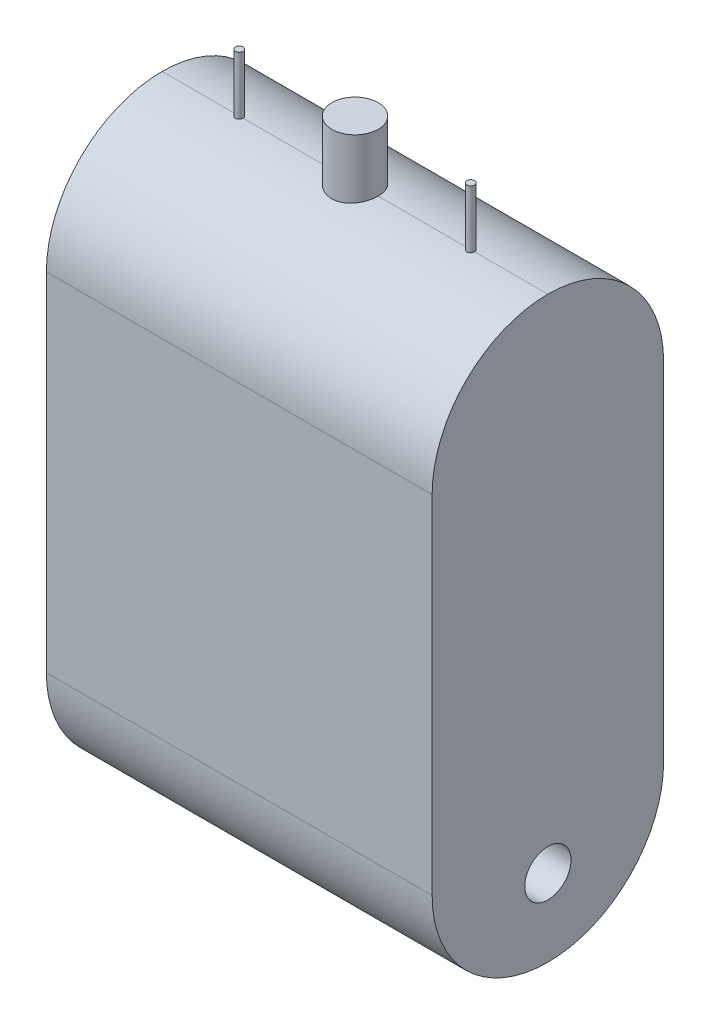
from build123d import *

# Parameters (mm, degrees)
EXTRUDE_1_DEPTH     = 30
SKETCH_2_R          = 3
CUT_EXTRUDE_1_DEPTH = 52
FILLET_1_R          = 15
FILLET_2_R          = 15
FILLET_3_R          = 15
FILLET_4_R          = 15
SKETCH_4_R          = 3
SKETCH_4_R_2        = 0.5
EXTRUDE_2_DEPTH     = 50


with BuildPart() as part:
    # 草图1 → 凸台-拉伸1 (new body)
    with BuildSketch(Plane.XY):
        Polygon((25, 0), (25, 42.5), (-25, 42.5), (-25, -32.5), (25, -32.5), align=None)
    extrude(amount=EXTRUDE_1_DEPTH)

    # 草图2 → 切除-拉伸1 (cut)
    with BuildSketch(Plane(origin=(25, 0, 0), x_dir=(0, 0, -1), z_dir=(1, 0, 0))):
        with Locations((-15, -22.5)):
            Circle(SKETCH_2_R)
    extrude(amount=-CUT_EXTRUDE_1_DEPTH, mode=Mode.SUBTRACT)

    # 圆角1
    fillet_1_edges = [part.edges().sort_by_distance(p)[0] for p in [
        (0, -32.5, 0),
    ]]
    fillet(fillet_1_edges, radius=FILLET_1_R)

    # 圆角2
    fillet_2_edges = [part.edges().sort_by_distance(p)[0] for p in [
        (0, -32.5, 30),
    ]]
    fillet(fillet_2_edges, radius=FILLET_2_R - 0.0001)  # a hair under: the kernel refuses the full size

    # 圆角3
    fillet_3_edges = [part.edges().sort_by_distance(p)[0] for p in [
        (0, 42.5, 30),
    ]]
    fillet(fillet_3_edges, radius=FILLET_3_R)

    # 圆角4
    fillet_4_edges = [part.edges().sort_by_distance(p)[0] for p in [
        (0, 42.5, 0),
    ]]
    fillet(fillet_4_edges, radius=FILLET_4_R - 0.0001)  # a hair under: the kernel refuses the full size

    # 草图4 → 凸台-拉伸2 (add)
    with BuildSketch(Plane(origin=(0, 0, 0), x_dir=(1, 0, 0), z_dir=(0, 1, 0))):
        with Locations((0, -15)):
            Circle(SKETCH_4_R)
        with Locations((15, -15)):
            Circle(SKETCH_4_R_2)
        with Locations((-15, -15)):
            Circle(SKETCH_4_R_2)
    extrude(amount=EXTRUDE_2_DEPTH)


solid = part.part
